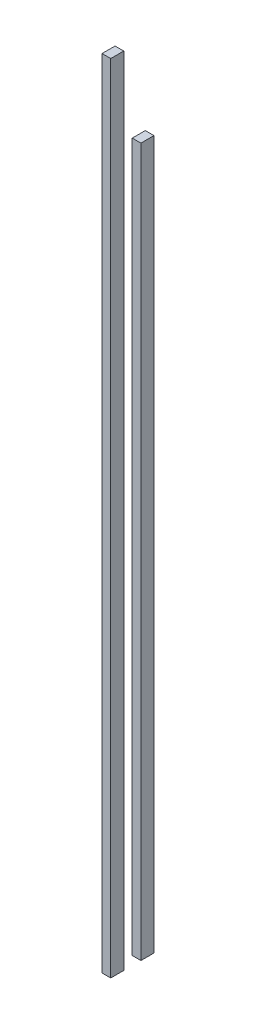
from build123d import *

# Parameters (mm, degrees)
EXTRUDE_THIN1_DEPTH   = 1.2
EXTRUDE_THIN1_2_DEPTH = 1.2


with BuildPart() as part:
    # Sketch1 → Extrude-Thin1 (new body)
    with BuildSketch(Plane.ZY.offset(3.1)):
        Polygon((1.627533342, 62.1), (1.627533342, 62), (1.627533342, -48), (3.427533342, -48), (3.427533342, 62), (3.427533342, 62.1), align=None)
    extrude(amount=EXTRUDE_THIN1_DEPTH)


with BuildPart() as body_2:
    # Sketch1 → Extrude-Thin1 2 (new body)
    with BuildSketch(Plane.ZY.offset(3.1)):
        Polygon((-2.546777409, 49.886309085), (-2.546777409, 49.786309085), (-2.546777409, -48), (-0.746777409, -48), (-0.746777409, 49.786309085), (-0.746777409, 49.886309085), align=None)
    extrude(amount=EXTRUDE_THIN1_2_DEPTH)


solid = Compound([part.part, body_2.part])
